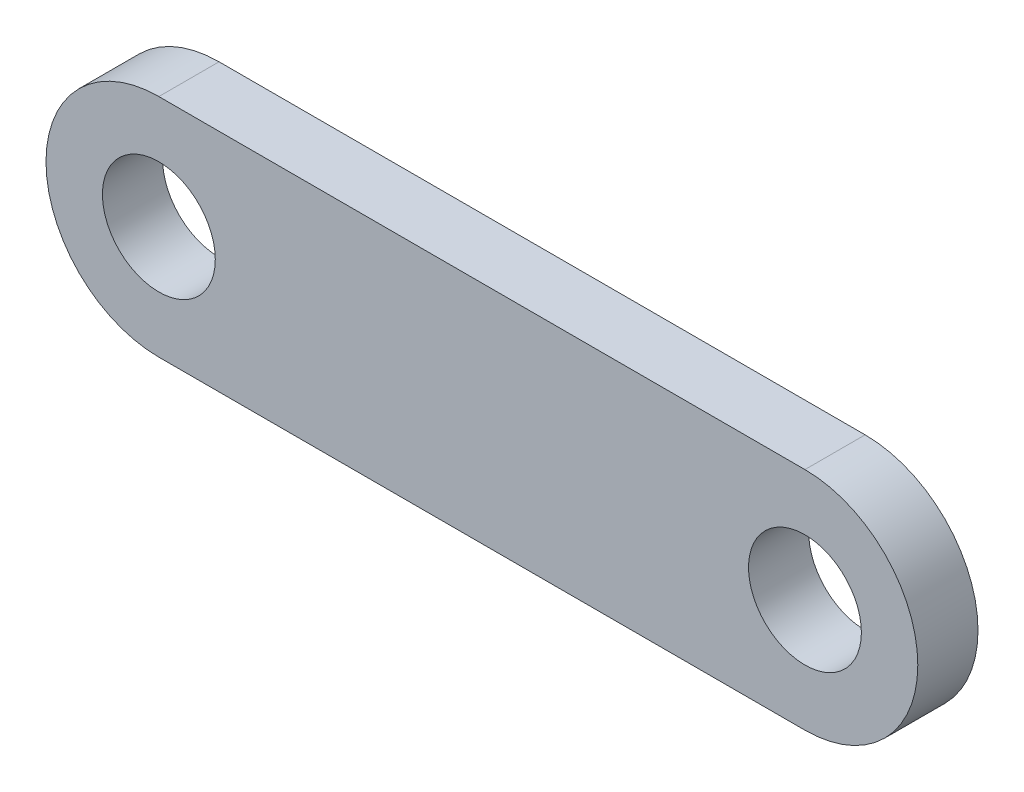
from build123d import *

# Parameters (mm, degrees)
SKETCH1_R           = 2.38125
BOSS_EXTRUDE2_DEPTH = 2.54


with BuildPart() as part:
    # Sketch1 → Boss-Extrude2 (new body)
    with BuildSketch(Plane.XY):
        with BuildLine():
            Line((27.264378288, 4.7625), (0, 4.7625))
            ThreePointArc((0, 4.7625), (-4.7625, 0), (0, -4.7625))
            Line((0, -4.7625), (27.264378288, -4.7625))
            ThreePointArc((27.264378288, -4.7625), (32.026878288, 0), (27.264378288, 4.7625))
        make_face()
        with Locations((27.264378288, 0)):
            Circle(SKETCH1_R, mode=Mode.SUBTRACT)
        Circle(SKETCH1_R, mode=Mode.SUBTRACT)
    extrude(amount=BOSS_EXTRUDE2_DEPTH)


solid = part.part
